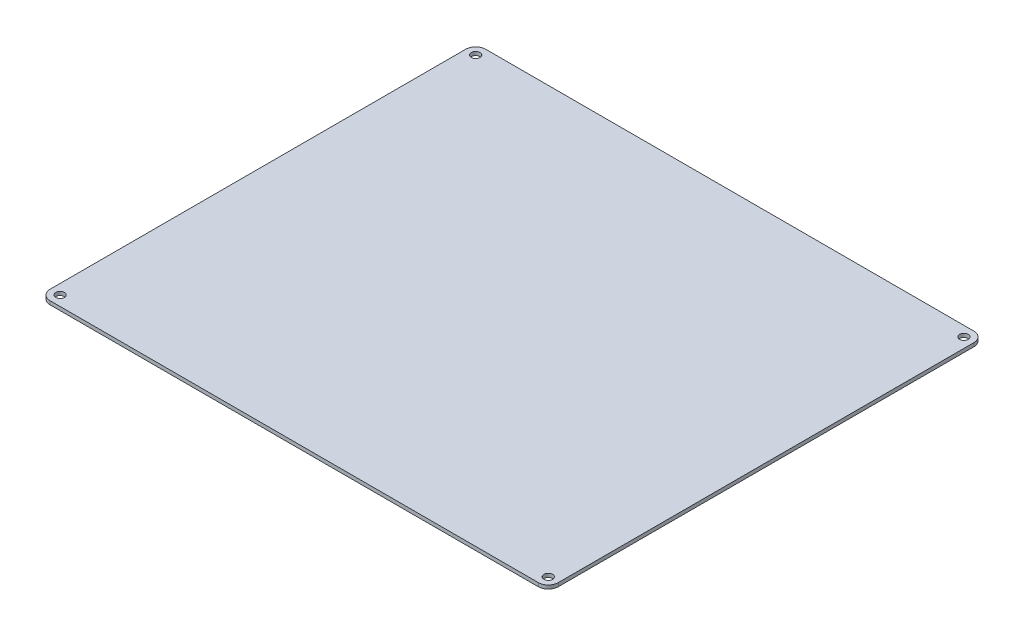
from build123d import *

# Parameters (mm, degrees)
SKETCH1_W           = 140
SKETCH1_H           = 120
SKETCH1_R           = 1.2
BOSS_EXTRUDE1_DEPTH = 1
FILLET1_R           = 2.75


with BuildPart() as part:
    # Sketch1 → Boss-Extrude1 (new body)
    with BuildSketch(Plane(origin=(0, 0, 0), x_dir=(1, 0, 0), z_dir=(0, 1, 0))):
        with Locations((70, -60)):
            Rectangle(SKETCH1_W, SKETCH1_H)
        with Locations((2.75, -2.75)):
            Circle(SKETCH1_R, mode=Mode.SUBTRACT)
        with Locations((137.25, -2.75)):
            Circle(SKETCH1_R, mode=Mode.SUBTRACT)
        with Locations((137.25, -117.25)):
            Circle(SKETCH1_R, mode=Mode.SUBTRACT)
        with Locations((2.75, -117.25)):
            Circle(SKETCH1_R, mode=Mode.SUBTRACT)
    extrude(amount=BOSS_EXTRUDE1_DEPTH)

    # Fillet1
    fillet1_edges = [part.edges().sort_by_distance(p)[0] for p in [
        (0, 0.5, 0),
        (140, 0.5, 0),
        (140, 0.5, 120),
        (0, 0.5, 120),
    ]]
    fillet(fillet1_edges, radius=FILLET1_R)


solid = part.part
